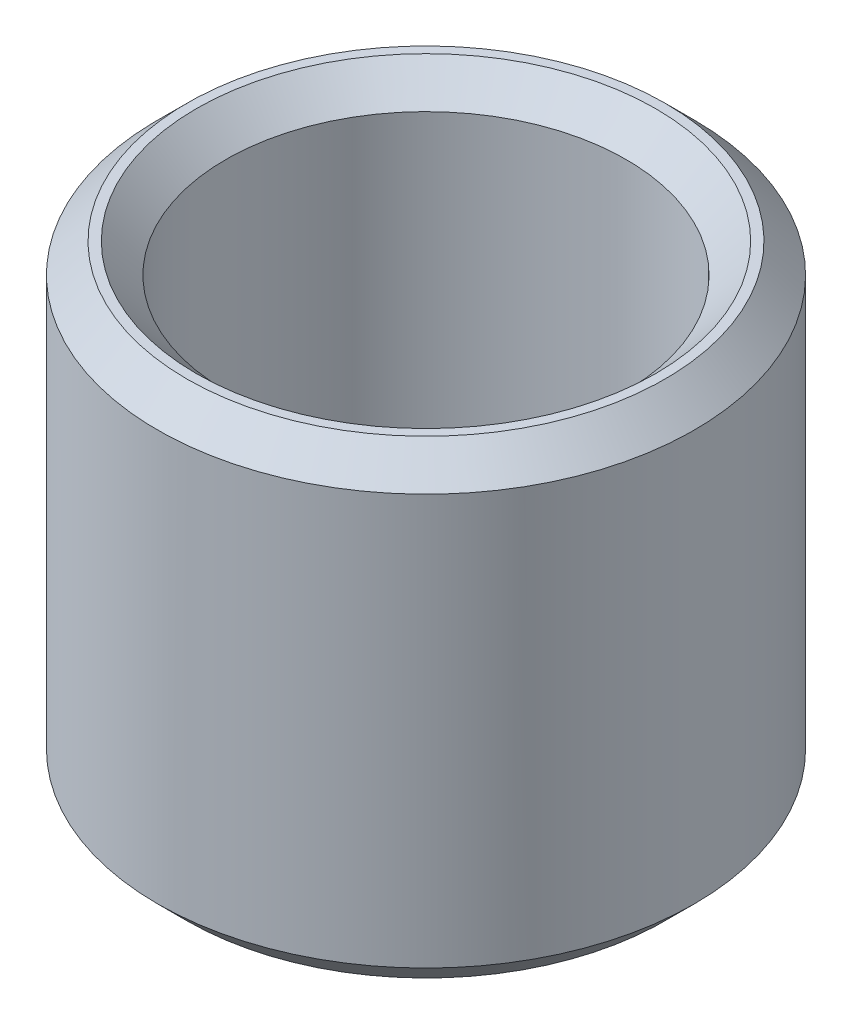
from build123d import *

# Parameters (mm, degrees)
SKETCH1_R           = 25
BOSS_EXTRUDE1_DEPTH = 43.699807386
SKETCH2_R           = 18.645850906
CUT_EXTRUDE1_DEPTH  = 57.210970153
CHAMFER1_SIZE       = 2.738299018


with BuildPart() as part:
    # Sketch1 → Boss-Extrude1 (new body)
    with BuildSketch(Plane(origin=(0, 0, 0), x_dir=(1, 0, 0), z_dir=(0, 1, 0))):
        Circle(SKETCH1_R)
    extrude(amount=BOSS_EXTRUDE1_DEPTH)

    # Sketch2 → Cut-Extrude1 (cut, through all)
    with BuildSketch(Plane(origin=(0, 0, 0), x_dir=(1, 0, 0), z_dir=(0, 1, 0))):
        Circle(SKETCH2_R)
    extrude(amount=CUT_EXTRUDE1_DEPTH, mode=Mode.SUBTRACT)

    # Chamfer1
    chamfer1_edges = [part.edges().sort_by_distance(p)[0] for p in [
        (-18.645850906, 43.699807386, 0),
        (-18.645850906, 0, 0),
        (-25, 0, 0),
        (-25, 43.699807386, 0),
    ]]
    chamfer(chamfer1_edges, length=CHAMFER1_SIZE)


solid = part.part
